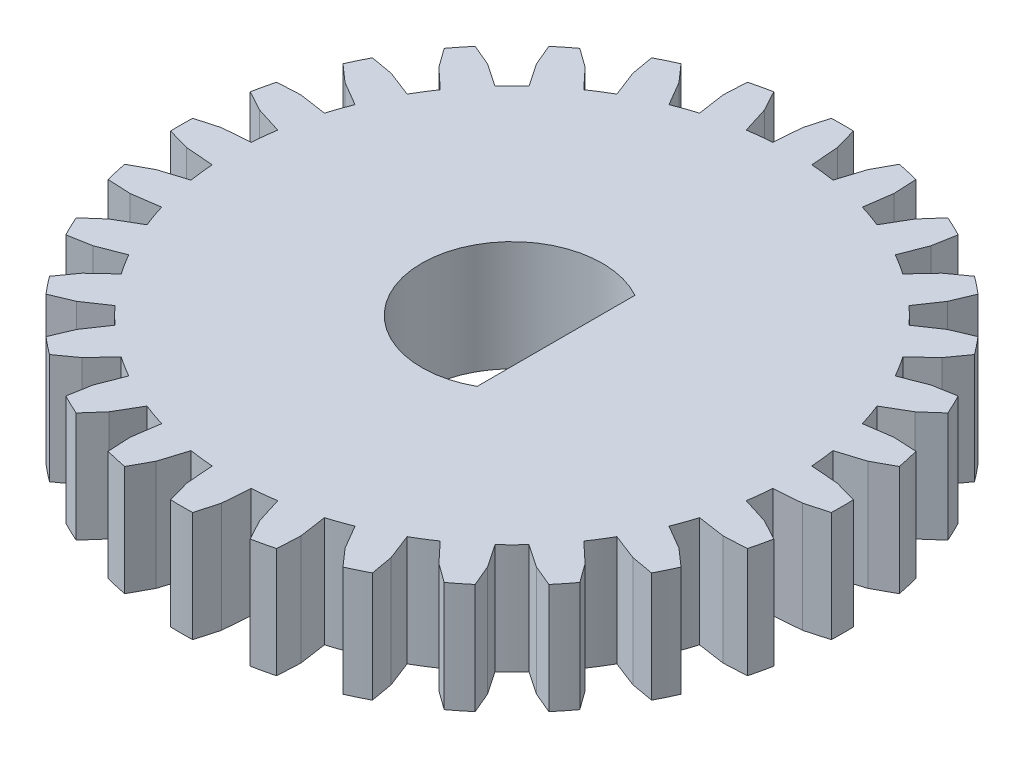
from build123d import *

# Parameters (mm, degrees)
BOSS_EXTRUDE1_DEPTH = 5
CIRPATTERN2_DEPTH   = 5


# Read off the part's stored shape, not the designer's step: CirPattern2
with BuildPart() as part:
    # Sketch1 → Boss-Extrude1 (new body)
    with BuildSketch(Plane(origin=(0, 0, 0), x_dir=(1, 0, 0), z_dir=(0, 1, 0))):
        with BuildLine():
            Line((0.885, 12.719248209), (0.785, 13.977974639))
            Line((0.785, 13.977974639), (0.5, 14.991664351))
            ThreePointArc((0.5, 14.991664351), (0, 15), (-0.5, 14.991664351))
            Line((-0.5, 14.991664351), (-0.785, 13.977974639))
            Line((-0.785, 13.977974639), (-0.885, 12.719248209))
            ThreePointArc((-0.885, 12.719248209), (0, -12.75), (0.885, 12.719248209))
        make_face()
        with BuildLine():
            Line((2, 3.579106034), (2, -3.579106034))
            ThreePointArc((2, -3.579106034), (-4.1, 0), (2, 3.579106034))
        make_face(mode=Mode.SUBTRACT)
    extrude(amount=BOSS_EXTRUDE1_DEPTH)

    # CirPattern2 outline → CirPattern2 (add)
    with BuildSketch(Plane(origin=(0, 0, 0), x_dir=(1, 0, 0), z_dir=(0, 1, 0))):
        with BuildLine():
            ThreePointArc((3.823423109, 14.504531558), (3.33781401, 14.623918683), (2.848495197, 14.727052492))
            Line((2.848495197, 14.727052492), (2.34507356, 13.802196564))
            Line((2.34507356, 13.802196564), (1.967487788, 12.597281128))
            ThreePointArc((1.967487788, 12.597281128), (2.837141908, 12.43033088), (3.693110193, 12.203419074))
            Line((3.693110193, 12.203419074), (3.875710382, 13.452838698))
            Line((3.875710382, 13.452838698), (3.823423109, 14.504531558))
        make_face()
        with BuildLine():
            Line((-3.875710382, 13.452838698), (-3.693110193, 12.203419074))
            ThreePointArc((-3.693110193, 12.203419074), (-2.837141908, 12.43033088), (-1.967487788, 12.597281128))
            Line((-1.967487788, 12.597281128), (-2.34507356, 13.802196564))
            Line((-2.34507356, 13.802196564), (-2.848495197, 14.727052492))
            ThreePointArc((-2.848495197, 14.727052492), (-3.33781401, 14.623918683), (-3.823423109, 14.504531558))
            Line((-3.823423109, 14.504531558), (-3.875710382, 13.452838698))
        make_face()
        with BuildLine():
            Line((-6.772076463, 12.253121251), (-6.31603242, 11.07565955))
            ThreePointArc((-6.31603242, 11.07565955), (-5.532017674, 11.487353066), (-4.721317524, 11.843633768))
            Line((-4.721317524, 11.843633768), (-5.35755534, 12.934318721))
            Line((-5.35755534, 12.934318721), (-6.05415495, 13.723964727))
            ThreePointArc((-6.05415495, 13.723964727), (-6.508256087, 13.514533019), (-6.955123818, 13.290080988))
            Line((-6.955123818, 13.290080988), (-6.772076463, 12.253121251))
        make_face()
        with BuildLine():
            Line((-9.328862352, 10.438981139), (-8.622242408, 9.392520208))
            ThreePointArc((-8.622242408, 9.392520208), (-7.949494974, 9.968351401), (-7.238400684, 10.496097158))
            Line((-7.238400684, 10.496097158), (-8.101386924, 11.417860128))
            Line((-8.101386924, 11.417860128), (-8.956234094, 12.032700065))
            ThreePointArc((-8.956234094, 12.032700065), (-9.352347028, 11.727472237), (-9.738065577, 11.409210263))
            Line((-9.738065577, 11.409210263), (-9.328862352, 10.438981139))
        make_face()
        with BuildLine():
            Line((-11.417860128, 8.101386924), (-10.496097158, 7.238400684))
            ThreePointArc((-10.496097158, 7.238400684), (-9.968351401, 7.949494974), (-9.392520208, 8.622242408))
            Line((-9.392520208, 8.622242408), (-10.438981139, 9.328862352))
            Line((-10.438981139, 9.328862352), (-11.409210263, 9.738065577))
            ThreePointArc((-11.409210263, 9.738065577), (-11.727472237, 9.352347028), (-12.032700065, 8.956234094))
            Line((-12.032700065, 8.956234094), (-11.417860128, 8.101386924))
        make_face()
        with BuildLine():
            Line((-12.934318721, 5.35755534), (-11.843633768, 4.721317524))
            ThreePointArc((-11.843633768, 4.721317524), (-11.487353066, 5.532017674), (-11.07565955, 6.31603242))
            Line((-11.07565955, 6.31603242), (-12.253121251, 6.772076463))
            Line((-12.253121251, 6.772076463), (-13.290080988, 6.955123818))
            ThreePointArc((-13.290080988, 6.955123818), (-13.514533019, 6.508256087), (-13.723964727, 6.05415495))
            Line((-13.723964727, 6.05415495), (-12.934318721, 5.35755534))
        make_face()
        with BuildLine():
            Line((-13.802196564, 2.34507356), (-12.597281127, 1.967487788))
            ThreePointArc((-12.597281127, 1.967487788), (-12.43033088, 2.837141908), (-12.203419074, 3.693110193))
            Line((-12.203419074, 3.693110193), (-13.452838698, 3.875710382))
            Line((-13.452838698, 3.875710382), (-14.504531558, 3.823423109))
            ThreePointArc((-14.504531558, 3.823423109), (-14.623918683, 3.33781401), (-14.727052492, 2.848495197))
            Line((-14.727052492, 2.848495197), (-13.802196564, 2.34507356))
        make_face()
        with BuildLine():
            Line((-13.977974639, -0.785), (-12.719248209, -0.885))
            ThreePointArc((-12.719248209, -0.885), (-12.75, 0), (-12.719248209, 0.885))
            Line((-12.719248209, 0.885), (-13.977974639, 0.785))
            Line((-13.977974639, 0.785), (-14.991664351, 0.5))
            ThreePointArc((-14.991664351, 0.5), (-15, 0), (-14.991664351, -0.5))
            Line((-14.991664351, -0.5), (-13.977974639, -0.785))
        make_face()
        with BuildLine():
            Line((-13.452838698, -3.875710382), (-12.203419074, -3.693110193))
            ThreePointArc((-12.203419074, -3.693110193), (-12.43033088, -2.837141908), (-12.597281127, -1.967487788))
            Line((-12.597281127, -1.967487788), (-13.802196564, -2.34507356))
            Line((-13.802196564, -2.34507356), (-14.727052492, -2.848495197))
            ThreePointArc((-14.727052492, -2.848495197), (-14.623918683, -3.33781401), (-14.504531558, -3.823423109))
            Line((-14.504531558, -3.823423109), (-13.452838698, -3.875710382))
        make_face()
        with BuildLine():
            Line((-12.253121251, -6.772076463), (-11.07565955, -6.31603242))
            ThreePointArc((-11.07565955, -6.31603242), (-11.487353066, -5.532017674), (-11.843633768, -4.721317524))
            Line((-11.843633768, -4.721317524), (-12.934318721, -5.35755534))
            Line((-12.934318721, -5.35755534), (-13.723964727, -6.05415495))
            ThreePointArc((-13.723964727, -6.05415495), (-13.514533019, -6.508256087), (-13.290080988, -6.955123818))
            Line((-13.290080988, -6.955123818), (-12.253121251, -6.772076463))
        make_face()
        with BuildLine():
            Line((-10.438981139, -9.328862352), (-9.392520208, -8.622242408))
            ThreePointArc((-9.392520208, -8.622242408), (-9.968351401, -7.949494974), (-10.496097158, -7.238400684))
            Line((-10.496097158, -7.238400684), (-11.417860128, -8.101386924))
            Line((-11.417860128, -8.101386924), (-12.032700065, -8.956234094))
            ThreePointArc((-12.032700065, -8.956234094), (-11.727472237, -9.352347028), (-11.409210263, -9.738065577))
            Line((-11.409210263, -9.738065577), (-10.438981139, -9.328862352))
        make_face()
        with BuildLine():
            Line((-8.101386924, -11.417860128), (-7.238400684, -10.496097158))
            ThreePointArc((-7.238400684, -10.496097158), (-7.949494974, -9.968351401), (-8.622242408, -9.392520208))
            Line((-8.622242408, -9.392520208), (-9.328862352, -10.438981139))
            Line((-9.328862352, -10.438981139), (-9.738065577, -11.409210263))
            ThreePointArc((-9.738065577, -11.409210263), (-9.352347028, -11.727472237), (-8.956234094, -12.032700065))
            Line((-8.956234094, -12.032700065), (-8.101386924, -11.417860128))
        make_face()
        with BuildLine():
            Line((-5.35755534, -12.934318721), (-4.721317524, -11.843633768))
            ThreePointArc((-4.721317524, -11.843633768), (-5.532017674, -11.487353066), (-6.31603242, -11.07565955))
            Line((-6.31603242, -11.07565955), (-6.772076463, -12.253121251))
            Line((-6.772076463, -12.253121251), (-6.955123818, -13.290080988))
            ThreePointArc((-6.955123818, -13.290080988), (-6.508256087, -13.514533019), (-6.05415495, -13.723964727))
            Line((-6.05415495, -13.723964727), (-5.35755534, -12.934318721))
        make_face()
        with BuildLine():
            Line((-2.34507356, -13.802196564), (-1.967487788, -12.597281127))
            ThreePointArc((-1.967487788, -12.597281127), (-2.837141908, -12.43033088), (-3.693110193, -12.203419074))
            Line((-3.693110193, -12.203419074), (-3.875710382, -13.452838698))
            Line((-3.875710382, -13.452838698), (-3.823423109, -14.504531558))
            ThreePointArc((-3.823423109, -14.504531558), (-3.33781401, -14.623918683), (-2.848495197, -14.727052492))
            Line((-2.848495197, -14.727052492), (-2.34507356, -13.802196564))
        make_face()
        with BuildLine():
            Line((0.785, -13.977974639), (0.885, -12.719248209))
            ThreePointArc((0.885, -12.719248209), (0, -12.75), (-0.885, -12.719248209))
            Line((-0.885, -12.719248209), (-0.785, -13.977974639))
            Line((-0.785, -13.977974639), (-0.5, -14.991664351))
            ThreePointArc((-0.5, -14.991664351), (0, -15), (0.5, -14.991664351))
            Line((0.5, -14.991664351), (0.785, -13.977974639))
        make_face()
        with BuildLine():
            Line((3.875710382, -13.452838698), (3.693110193, -12.203419074))
            ThreePointArc((3.693110193, -12.203419074), (2.837141908, -12.43033088), (1.967487788, -12.597281127))
            Line((1.967487788, -12.597281127), (2.34507356, -13.802196564))
            Line((2.34507356, -13.802196564), (2.848495197, -14.727052492))
            ThreePointArc((2.848495197, -14.727052492), (3.33781401, -14.623918683), (3.823423109, -14.504531558))
            Line((3.823423109, -14.504531558), (3.875710382, -13.452838698))
        make_face()
        with BuildLine():
            Line((6.772076463, -12.253121251), (6.31603242, -11.07565955))
            ThreePointArc((6.31603242, -11.07565955), (5.532017674, -11.487353066), (4.721317524, -11.843633768))
            Line((4.721317524, -11.843633768), (5.35755534, -12.934318721))
            Line((5.35755534, -12.934318721), (6.05415495, -13.723964727))
            ThreePointArc((6.05415495, -13.723964727), (6.508256087, -13.514533019), (6.955123818, -13.290080988))
            Line((6.955123818, -13.290080988), (6.772076463, -12.253121251))
        make_face()
        with BuildLine():
            Line((9.328862352, -10.438981139), (8.622242408, -9.392520208))
            ThreePointArc((8.622242408, -9.392520208), (7.949494974, -9.968351401), (7.238400684, -10.496097158))
            Line((7.238400684, -10.496097158), (8.101386924, -11.417860128))
            Line((8.101386924, -11.417860128), (8.956234094, -12.032700065))
            ThreePointArc((8.956234094, -12.032700065), (9.352347028, -11.727472237), (9.738065577, -11.409210263))
            Line((9.738065577, -11.409210263), (9.328862352, -10.438981139))
        make_face()
        with BuildLine():
            Line((11.417860128, -8.101386924), (10.496097158, -7.238400684))
            ThreePointArc((10.496097158, -7.238400684), (9.968351401, -7.949494974), (9.392520208, -8.622242408))
            Line((9.392520208, -8.622242408), (10.438981139, -9.328862352))
            Line((10.438981139, -9.328862352), (11.409210263, -9.738065577))
            ThreePointArc((11.409210263, -9.738065577), (11.727472237, -9.352347028), (12.032700065, -8.956234094))
            Line((12.032700065, -8.956234094), (11.417860128, -8.101386924))
        make_face()
        with BuildLine():
            Line((12.934318721, -5.35755534), (11.843633768, -4.721317524))
            ThreePointArc((11.843633768, -4.721317524), (11.487353066, -5.532017674), (11.07565955, -6.31603242))
            Line((11.07565955, -6.31603242), (12.253121251, -6.772076463))
            Line((12.253121251, -6.772076463), (13.290080988, -6.955123818))
            ThreePointArc((13.290080988, -6.955123818), (13.514533019, -6.508256087), (13.723964727, -6.05415495))
            Line((13.723964727, -6.05415495), (12.934318721, -5.35755534))
        make_face()
        with BuildLine():
            Line((13.802196564, -2.34507356), (12.597281127, -1.967487788))
            ThreePointArc((12.597281127, -1.967487788), (12.43033088, -2.837141908), (12.203419074, -3.693110193))
            Line((12.203419074, -3.693110193), (13.452838698, -3.875710382))
            Line((13.452838698, -3.875710382), (14.504531558, -3.823423109))
            ThreePointArc((14.504531558, -3.823423109), (14.623918683, -3.33781401), (14.727052492, -2.848495197))
            Line((14.727052492, -2.848495197), (13.802196564, -2.34507356))
        make_face()
        with BuildLine():
            Line((13.977974639, 0.785), (12.719248209, 0.885))
            ThreePointArc((12.719248209, 0.885), (12.75, 0), (12.719248209, -0.885))
            Line((12.719248209, -0.885), (13.977974639, -0.785))
            Line((13.977974639, -0.785), (14.991664351, -0.5))
            ThreePointArc((14.991664351, -0.5), (15, 0), (14.991664351, 0.5))
            Line((14.991664351, 0.5), (13.977974639, 0.785))
        make_face()
        with BuildLine():
            Line((13.452838698, 3.875710382), (12.203419074, 3.693110193))
            ThreePointArc((12.203419074, 3.693110193), (12.43033088, 2.837141908), (12.597281127, 1.967487788))
            Line((12.597281127, 1.967487788), (13.802196564, 2.34507356))
            Line((13.802196564, 2.34507356), (14.727052492, 2.848495197))
            ThreePointArc((14.727052492, 2.848495197), (14.623918683, 3.33781401), (14.504531558, 3.823423109))
            Line((14.504531558, 3.823423109), (13.452838698, 3.875710382))
        make_face()
        with BuildLine():
            Line((12.253121251, 6.772076463), (11.07565955, 6.31603242))
            ThreePointArc((11.07565955, 6.31603242), (11.487353066, 5.532017674), (11.843633768, 4.721317524))
            Line((11.843633768, 4.721317524), (12.934318721, 5.35755534))
            Line((12.934318721, 5.35755534), (13.723964727, 6.05415495))
            ThreePointArc((13.723964727, 6.05415495), (13.514533019, 6.508256087), (13.290080988, 6.955123818))
            Line((13.290080988, 6.955123818), (12.253121251, 6.772076463))
        make_face()
        with BuildLine():
            Line((10.438981139, 9.328862352), (9.392520208, 8.622242408))
            ThreePointArc((9.392520208, 8.622242408), (9.968351401, 7.949494974), (10.496097158, 7.238400684))
            Line((10.496097158, 7.238400684), (11.417860128, 8.101386924))
            Line((11.417860128, 8.101386924), (12.032700065, 8.956234094))
            ThreePointArc((12.032700065, 8.956234094), (11.727472237, 9.352347028), (11.409210263, 9.738065577))
            Line((11.409210263, 9.738065577), (10.438981139, 9.328862352))
        make_face()
        with BuildLine():
            Line((8.101386924, 11.417860128), (7.238400684, 10.496097158))
            ThreePointArc((7.238400684, 10.496097158), (7.949494974, 9.968351401), (8.622242408, 9.392520208))
            Line((8.622242408, 9.392520208), (9.328862352, 10.438981139))
            Line((9.328862352, 10.438981139), (9.738065577, 11.409210263))
            ThreePointArc((9.738065577, 11.409210263), (9.352347028, 11.727472237), (8.956234094, 12.032700065))
            Line((8.956234094, 12.032700065), (8.101386924, 11.417860128))
        make_face()
        with BuildLine():
            Line((5.35755534, 12.934318721), (4.721317524, 11.843633768))
            ThreePointArc((4.721317524, 11.843633768), (5.532017674, 11.487353066), (6.31603242, 11.07565955))
            Line((6.31603242, 11.07565955), (6.772076463, 12.253121251))
            Line((6.772076463, 12.253121251), (6.955123818, 13.290080988))
            ThreePointArc((6.955123818, 13.290080988), (6.508256087, 13.514533019), (6.05415495, 13.723964727))
            Line((6.05415495, 13.723964727), (5.35755534, 12.934318721))
        make_face()
    extrude(amount=CIRPATTERN2_DEPTH)


solid = part.part
